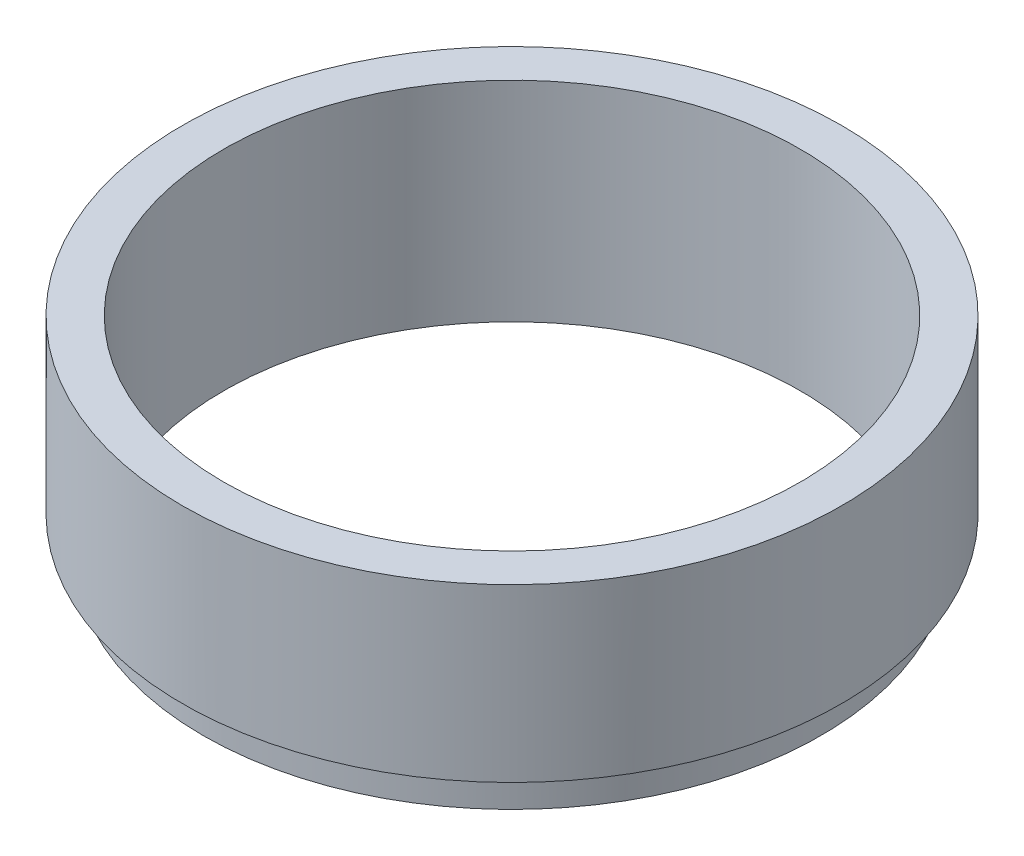
from build123d import *

# Parameters (mm, degrees)
SKETCH1_R           = 40
SKETCH1_R_2         = 35
BOSS_EXTRUDE1_DEPTH = 25.4
SKETCH2_R           = 40
SKETCH2_R_2         = 37.5
CUT_EXTRUDE1_DEPTH  = 4.6


with BuildPart() as part:
    # Sketch1 → Boss-Extrude1 (new body)
    with BuildSketch(Plane(origin=(0, 0, 0), x_dir=(1, 0, 0), z_dir=(0, 1, 0))):
        Circle(SKETCH1_R)
        Circle(SKETCH1_R_2, mode=Mode.SUBTRACT)
    extrude(amount=BOSS_EXTRUDE1_DEPTH)

    # Sketch2 → Cut-Extrude1 (cut)
    with BuildSketch(Plane.XZ):
        Circle(SKETCH2_R)
        Circle(SKETCH2_R_2, mode=Mode.SUBTRACT)
    extrude(amount=-CUT_EXTRUDE1_DEPTH, mode=Mode.SUBTRACT)


solid = part.part
